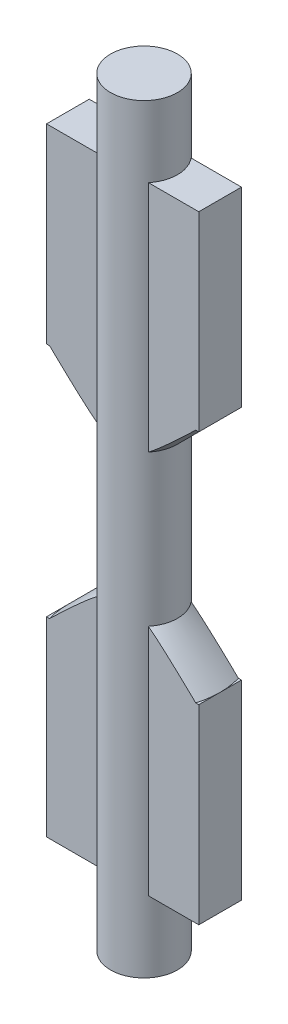
from build123d import *
from build123d.topology import SkipClean

# Parameters (mm, degrees)
SKETCH1_R           = 2.35
BOSS_EXTRUDE1_DEPTH = 5
BOSS_EXTRUDE2_DEPTH = 13.4
BOSS_EXTRUDE3_START = 18.4
SKETCH1_2_R         = 2.35
BOSS_EXTRUDE3_DEPTH = 16.6
BOSS_EXTRUDE4_START = 30
SKETCH2_2_R         = 2.35
BOSS_EXTRUDE4_DEPTH = 13.4
BOSS_EXTRUDE5_START = 48.4
SKETCH1_3_R         = 2.35
BOSS_EXTRUDE5_DEPTH = 5
CHAMFER1_SIZE       = 3


with BuildPart() as part:
    # Sketch1 → Boss-Extrude1 (new body)
    with BuildSketch(Plane(origin=(0, 0, 0), x_dir=(1, 0, 0), z_dir=(0, 1, 0))):
        with Locations(Location((0, 0, 0), (0, 0, 270))):
            Circle(SKETCH1_R)
    extrude(amount=BOSS_EXTRUDE1_DEPTH)

    # Sketch2 → Boss-Extrude2 (add)
    with SkipClean():  # the faces are left unmerged after this step: merging them gives an invalid solid
        with BuildSketch(Plane(origin=(0, 5, 0), x_dir=(1, 0, 0), z_dir=(0, 1, 0))):
            with BuildLine():
                Line((-1.809005, -1.5), (-5.35, -1.5))
                Line((-5.35, -1.5), (-5.35, 1.5))
                Line((-5.35, 1.5), (-1.809005, 1.5))
                ThreePointArc((-1.809005, 1.5), (0, 2.35), (1.809005, 1.5))
                Line((1.809005, 1.5), (5.35, 1.5))
                Line((5.35, 1.5), (5.35, -1.5))
                Line((5.35, -1.5), (1.809005, -1.5))
                ThreePointArc((1.809005, -1.5), (0, -2.35), (-1.809005, -1.5))
            make_face()
        extrude(amount=BOSS_EXTRUDE2_DEPTH)

    # Sketch1<2> → Boss-Extrude3 (add)
    with SkipClean():  # the faces are left unmerged after this step: merging them gives an invalid solid
        with BuildSketch(Plane(origin=(0, 0, 0), x_dir=(1, 0, 0), z_dir=(0, 1, 0)).offset(BOSS_EXTRUDE3_START)):
            with Locations(Location((0, 0, 0), (0, 0, 270))):
                Circle(SKETCH1_2_R)
        extrude(amount=BOSS_EXTRUDE3_DEPTH)

    # Sketch2<2> → Boss-Extrude4 (add)
    with SkipClean():  # the faces are left unmerged after this step: merging them gives an invalid solid
        with BuildSketch(Plane(origin=(0, 5, 0), x_dir=(1, 0, 0), z_dir=(0, 1, 0)).offset(BOSS_EXTRUDE4_START)):
            with Locations(Location((0, 0, 0), (0, 0, 140.334987))):
                Circle(SKETCH2_2_R)
            with BuildLine():
                Line((-1.809005, -1.5), (-5.35, -1.5))
                Line((-5.35, -1.5), (-5.35, 1.5))
                Line((-5.35, 1.5), (-1.809005, 1.5))
                ThreePointArc((-1.809005, 1.5), (0, 2.35), (1.809005, 1.5))
                Line((1.809005, 1.5), (5.35, 1.5))
                Line((5.35, 1.5), (5.35, -1.5))
                Line((5.35, -1.5), (1.809005, -1.5))
                ThreePointArc((1.809005, -1.5), (0, -2.35), (-1.809005, -1.5))
            make_face()
        extrude(amount=BOSS_EXTRUDE4_DEPTH)

    # Sketch1<3> → Boss-Extrude5 (add)
    with SkipClean():  # the faces are left unmerged after this step: merging them gives an invalid solid
        with BuildSketch(Plane(origin=(0, 0, 0), x_dir=(1, 0, 0), z_dir=(0, 1, 0)).offset(BOSS_EXTRUDE5_START)):
            with Locations(Location((0, 0, 0), (0, 0, 270))):
                Circle(SKETCH1_3_R)
        extrude(amount=BOSS_EXTRUDE5_DEPTH)

    # Chamfer1
    # the kernel refuses this chamfer: 3 mm, written as the material it adds along each edge
    with BuildSketch(Plane(origin=(0, 18.4, 0), x_dir=(0.9999950652018581, 0, -0.0031415874858791225), z_dir=(0.0031415874858791225, 0, 0.9999950652018581))) as chamfer1_piece_1_section:
        Polygon((2.35, CHAMFER1_SIZE), (2.35 + CHAMFER1_SIZE, 0), (2.35, 0), align=None)
    chamfer1_piece_1 = revolve(axis=Axis((0, 18.4, 0), (0, 1, 0)), revolution_arc=359.64, mode=Mode.PRIVATE)
    chamfer1_piece_1 = split(chamfer1_piece_1, bisect_by=Plane(origin=(3.194483, 19.397878, 1.5), z_dir=(0, 0, -1)), keep=Keep.TOP, mode=Mode.PRIVATE)
    chamfer1_piece_1 = split(chamfer1_piece_1, bisect_by=Plane(origin=(3.194483, 19.397878, -1.5), z_dir=(0, 0, 1)), keep=Keep.TOP, mode=Mode.PRIVATE)
    chamfer1_piece_1 = split(chamfer1_piece_1, bisect_by=Plane(origin=(-5.35, 19.397878, -0.77195), z_dir=(1, 0, 0)), keep=Keep.TOP, mode=Mode.PRIVATE)
    add(chamfer1_piece_1)
    with BuildSketch(Plane(origin=(0, 18.4, 0), x_dir=(-0.9999950652018581, 0, 0.0031415874858796884), z_dir=(-0.0031415874858796884, 0, -0.9999950652018581))) as chamfer1_piece_2_section:
        Polygon((2.35, CHAMFER1_SIZE), (2.35 + CHAMFER1_SIZE, 0), (2.35, 0), align=None)
    chamfer1_piece_2 = revolve(axis=Axis((0, 18.4, 0), (0, 1, 0)), revolution_arc=359.64, mode=Mode.PRIVATE)
    chamfer1_piece_2 = split(chamfer1_piece_2, bisect_by=Plane(origin=(-3.194483, 19.397878, 1.5), z_dir=(0, 0, -1)), keep=Keep.TOP, mode=Mode.PRIVATE)
    chamfer1_piece_2 = split(chamfer1_piece_2, bisect_by=Plane(origin=(-3.194483, 19.397878, -1.5), z_dir=(0, 0, 1)), keep=Keep.TOP, mode=Mode.PRIVATE)
    chamfer1_piece_2 = split(chamfer1_piece_2, bisect_by=Plane(origin=(5.35, 19.397878, 0.77195), z_dir=(-1, 0, 0)), keep=Keep.TOP, mode=Mode.PRIVATE)
    add(chamfer1_piece_2)
    with BuildSketch(Plane(origin=(0, 35, 0), x_dir=(-0.9999950652018581, 0, 0.0031415874858796884), z_dir=(-0.0031415874858796884, 0, -0.9999950652018581))) as chamfer1_piece_3_section:
        Polygon((2.35, -CHAMFER1_SIZE), (2.35 + CHAMFER1_SIZE, 0), (2.35, 0), align=None)
    chamfer1_piece_3 = revolve(axis=Axis((0, 35, 0), (0, 1, 0)), revolution_arc=359.64, mode=Mode.PRIVATE)
    chamfer1_piece_3 = split(chamfer1_piece_3, bisect_by=Plane(origin=(-3.194483, 34.002122, 1.5), z_dir=(0, 0, -1)), keep=Keep.TOP, mode=Mode.PRIVATE)
    chamfer1_piece_3 = split(chamfer1_piece_3, bisect_by=Plane(origin=(-3.194483, 34.002122, -1.5), z_dir=(0, 0, 1)), keep=Keep.TOP, mode=Mode.PRIVATE)
    chamfer1_piece_3 = split(chamfer1_piece_3, bisect_by=Plane(origin=(5.35, 34.002122, 0.77195), z_dir=(-1, 0, 0)), keep=Keep.TOP, mode=Mode.PRIVATE)
    add(chamfer1_piece_3)
    with BuildSketch(Plane(origin=(0, 35, 0), x_dir=(0.9999950652018625, 0, -0.0031415874844589325), z_dir=(0.0031415874844589325, 0, 0.9999950652018625))) as chamfer1_piece_4_section:
        Polygon((2.35, -CHAMFER1_SIZE), (2.35 + CHAMFER1_SIZE, 0), (2.35, 0), align=None)
    chamfer1_piece_4 = revolve(axis=Axis((0, 35, 0), (0, 1, 0)), revolution_arc=359.64, mode=Mode.PRIVATE)
    chamfer1_piece_4 = split(chamfer1_piece_4, bisect_by=Plane(origin=(3.194483, 34.002122, 1.5), z_dir=(0, 0, -1)), keep=Keep.TOP, mode=Mode.PRIVATE)
    chamfer1_piece_4 = split(chamfer1_piece_4, bisect_by=Plane(origin=(-5.35, 34.002122, -0.77195), z_dir=(1, 0, 0)), keep=Keep.TOP, mode=Mode.PRIVATE)
    chamfer1_piece_4 = split(chamfer1_piece_4, bisect_by=Plane(origin=(3.194483, 34.002122, -1.5), z_dir=(0, 0, 1)), keep=Keep.TOP, mode=Mode.PRIVATE)
    add(chamfer1_piece_4)


solid = part.part
